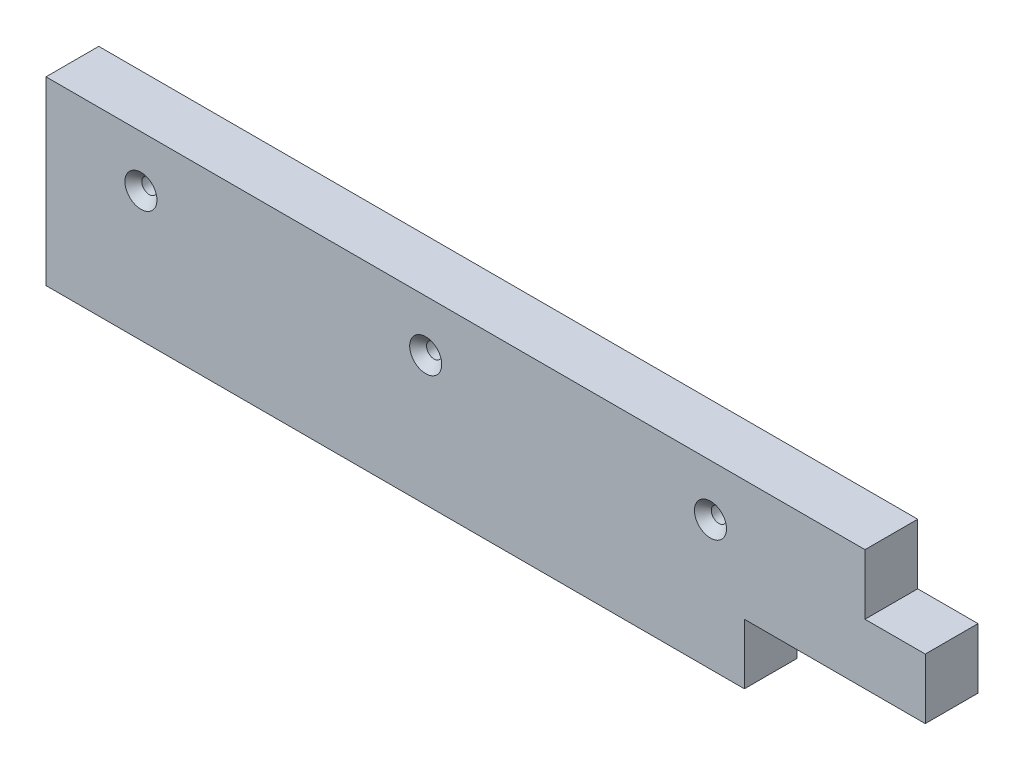
from build123d import *

# Parameters (mm, degrees)
SKETCH1_W                                            = 370.50412818
SKETCH1_H                                            = 22.225
BOSS_EXTRUDE1_DEPTH                                  = 38.1
CSK_FOR_M6_HEX_SOCKET_COUNTERSUNK_HEAD_S_D           = 6.4
CSK_FOR_M6_HEX_SOCKET_COUNTERSUNK_HEAD_S_CSINK_D     = 13.5
CSK_FOR_M6_HEX_SOCKET_COUNTERSUNK_HEAD_S_CSINK_ANGLE = 90
SKETCH3_W                                            = 25.4
SKETCH3_H                                            = 25.4
SKETCH3_W_2                                          = 76.2
CUT_EXTRUDE1_DEPTH                                   = 191.4307955


with BuildPart() as part:
    # Sketch1 → Boss-Extrude1 (new, symmetric)
    with BuildSketch(Plane(origin=(0, 0, 0), x_dir=(1, 0, 0), z_dir=(0, 1, 0))):
        Rectangle(SKETCH1_W, SKETCH1_H)
    extrude(amount=BOSS_EXTRUDE1_DEPTH, both=True)

    # CSK for M6 Hex Socket Countersunk Head Screw6 (through all)
    with Locations(Plane.XY.offset(11.1125)):
        with Locations((-145.252063971, 16.50746), (-25.252063971, 16.50746), (94.747936029, 16.50746)):
            CounterSinkHole(CSK_FOR_M6_HEX_SOCKET_COUNTERSUNK_HEAD_S_D / 2, CSK_FOR_M6_HEX_SOCKET_COUNTERSUNK_HEAD_S_CSINK_D / 2, counter_sink_angle=CSK_FOR_M6_HEX_SOCKET_COUNTERSUNK_HEAD_S_CSINK_ANGLE)

    # Sketch3 → Cut-Extrude1 (cut, through all)
    with BuildSketch(Plane.XY.offset(11.1125)):
        with Locations((172.55206409, 25.4)):
            Rectangle(SKETCH3_W, SKETCH3_H)
        with Locations((147.15206409, -25.4)):
            Rectangle(SKETCH3_W_2, SKETCH3_H)
    extrude(amount=-CUT_EXTRUDE1_DEPTH, mode=Mode.SUBTRACT)


solid = part.part
